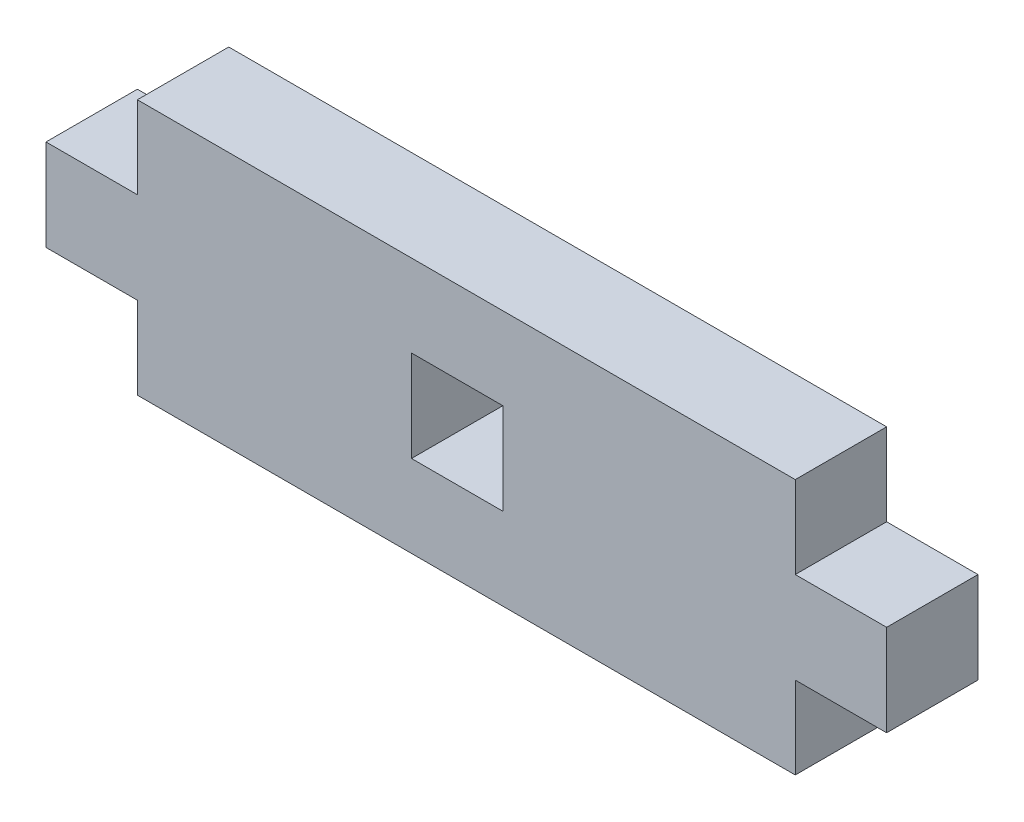
from build123d import *

# Parameters (mm, degrees)
BOSS_EXTRUDE1_DEPTH = 5
SKETCH3_W           = 5
SKETCH3_H           = 5
CUT_EXTRUDE1_DEPTH  = 49.342527861


with BuildPart() as part:
    # Sketch2 → Boss-Extrude1 (new body)
    with BuildSketch(Plane.XY):
        Polygon((0, 4.5), (0, 9.5), (5, 9.5), (5, 14), (41, 14), (41, 9.5), (46, 9.5), (46, 4.5), (41, 4.5), (41, 0), (5, 0), (5, 4.5), align=None)
    extrude(amount=BOSS_EXTRUDE1_DEPTH)

    # Sketch3 → Cut-Extrude1 (cut, through all)
    with BuildSketch(Plane.XY.offset(5)):
        with Locations((22.5, 7)):
            Rectangle(SKETCH3_W, SKETCH3_H)
    extrude(amount=-CUT_EXTRUDE1_DEPTH, mode=Mode.SUBTRACT)


solid = part.part
